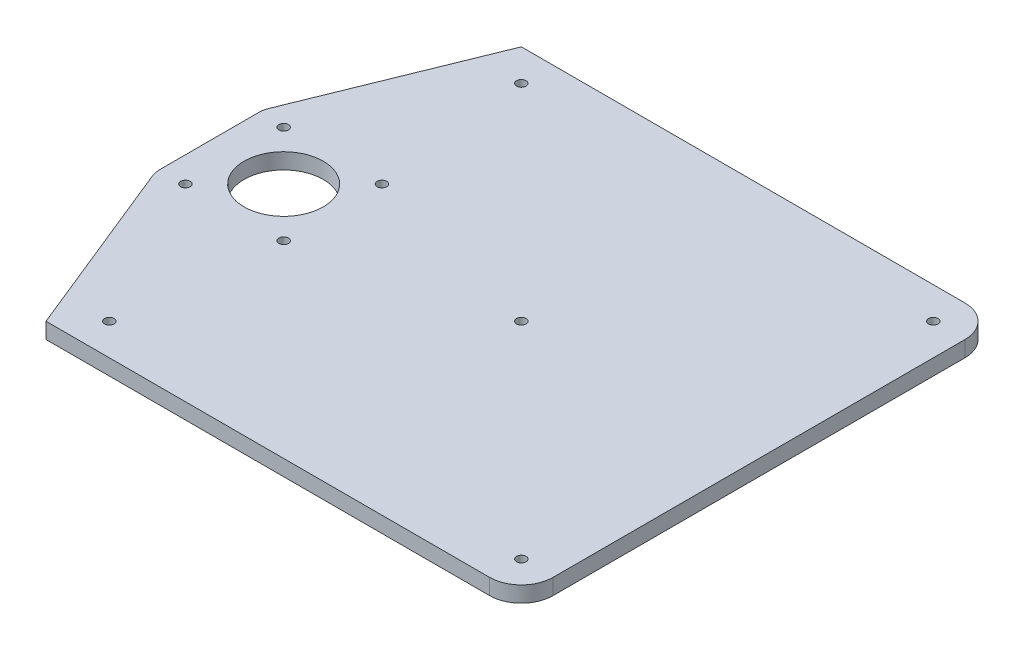
from build123d import *

# Parameters (mm, degrees)
SKETCH1_R           = 1.5
SKETCH1_R_2         = 12.5
BOSS_EXTRUDE1_DEPTH = 5


with BuildPart() as part:
    # Sketch1 → Boss-Extrude1 (new body)
    with BuildSketch(Plane(origin=(0, 0, 0), x_dir=(1, 0, 0), z_dir=(0, 1, 0))):
        with BuildLine():
            Line((-75, -75), (65, -75))
            ThreePointArc((65, -75), (72.071067812, -72.071067812), (75, -65))
            Line((75, -65), (75, 65))
            ThreePointArc((75, 65), (72.071067812, 72.071067812), (65, 75))
            Line((65, 75), (-75, 75))
            Line((-75, 75), (-97.913420794, 18.506857518))
            ThreePointArc((-97.913420794, 18.506857518), (-98.351985938, 17.031769181), (-98.5, 15.5))
            Line((-98.5, 15.5), (-98.5, -15.5))
            ThreePointArc((-98.5, -15.5), (-98.351985938, -17.031769181), (-97.913420794, -18.506857518))
            Line((-97.913420794, -18.506857518), (-75, -75))
        make_face()
        with Locations((-90.5, 15.5)):
            Circle(SKETCH1_R, mode=Mode.SUBTRACT)
        with Locations((-90.5, -15.5)):
            Circle(SKETCH1_R, mode=Mode.SUBTRACT)
        with Locations((-59.5, -15.5)):
            Circle(SKETCH1_R, mode=Mode.SUBTRACT)
        with Locations((-59.5, 15.5)):
            Circle(SKETCH1_R, mode=Mode.SUBTRACT)
        with Locations((-75, 0)):
            Circle(SKETCH1_R_2, mode=Mode.SUBTRACT)
        with Locations((-65, 65)):
            Circle(SKETCH1_R, mode=Mode.SUBTRACT)
        with Locations((65, 65)):
            Circle(SKETCH1_R, mode=Mode.SUBTRACT)
        with Locations((65, -65)):
            Circle(SKETCH1_R, mode=Mode.SUBTRACT)
        with Locations((-65, -65)):
            Circle(SKETCH1_R, mode=Mode.SUBTRACT)
        Circle(SKETCH1_R, mode=Mode.SUBTRACT)
    extrude(amount=BOSS_EXTRUDE1_DEPTH)


solid = part.part
